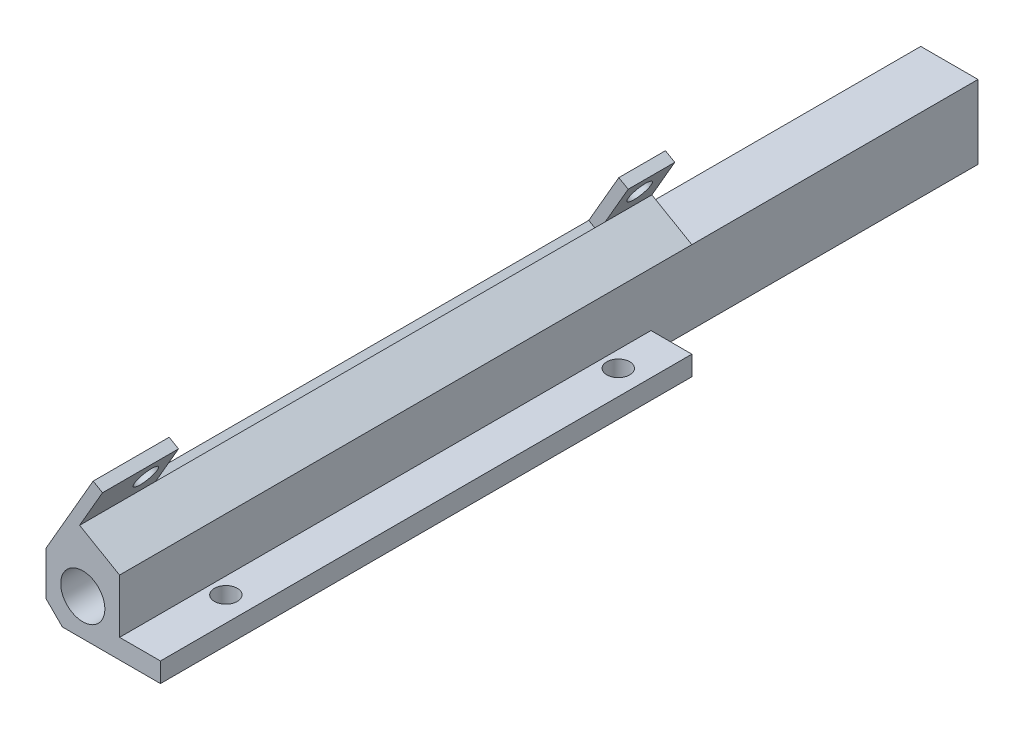
from build123d import *

# Parameters (mm, degrees)
SKETCH1_W           = 77.47
SKETCH1_H           = 133.35
BOSS_EXTRUDE1_DEPTH = 11.43
SKETCH2_R           = 3.429
CUT_EXTRUDE1_DEPTH  = 155.643035084
CUT_EXTRUDE2_DEPTH  = 155.643035084
SKETCH4_W           = 54.61
SKETCH4_H           = 6.35
CUT_EXTRUDE3_DEPTH  = 155.643035084
CHAMFER1_SIZE       = 2.54
CUT_EXTRUDE4_DEPTH  = 155.643035084
SKETCH6_W           = 53.34
SKETCH6_H           = 82.55
CUT_EXTRUDE5_DEPTH  = 155.643035084
SKETCH7_R           = 1.778
HOLE_CUTS_1_DEPTH   = 136.664298546
BOSS_EXTRUDE5_DEPTH = 88.9
SKETCH18_W          = 6.35
SKETCH18_H          = 5.08
CUT_EXTRUDE13_DEPTH = 76.2
HOLE_CUTS_2_REACH   = 139.395
SKETCH19_R          = 1.778
SKETCH20_W          = 88.9
SKETCH20_H          = 11.176
CUT_EXTRUDE16_DEPTH = 1.27
CUT_EXTRUDE22_DEPTH = 138.119873732
SKETCH22_W          = 6.35
SKETCH22_H          = 82.55
CUT_EXTRUDE18_DEPTH = 2.032
SKETCH23_W          = 1.676805636
SKETCH23_H          = 88.9
BOSS_EXTRUDE6_DEPTH = 1.27
CUT_EXTRUDE19_REACH = 139.539
SKETCH24_W          = 69.85
SKETCH24_H          = 9.3345
CUT_EXTRUDE20_REACH = 137.332
SKETCH25_W          = 1.27
SKETCH25_H          = 88.9
CUT_EXTRUDE21_REACH = 138.569
SKETCH26_W          = 6.35
SKETCH26_H          = 6.35


with BuildPart() as part:
    # Sketch1 → Boss-Extrude1 (new body)
    with BuildSketch(Plane(origin=(0, 0, 0), x_dir=(1, 0, 0), z_dir=(0, 1, 0))):
        with Locations((38.735, 66.675)):
            Rectangle(SKETCH1_W, SKETCH1_H)
    extrude(amount=BOSS_EXTRUDE1_DEPTH)

    # Sketch2 → Cut-Extrude1 (cut, through all)
    with BuildSketch(Plane.XY):
        with Locations((5.715, 5.715)):
            Circle(SKETCH2_R)
        with Locations((71.755, 5.715)):
            Circle(SKETCH2_R)
    extrude(amount=-CUT_EXTRUDE1_DEPTH, mode=Mode.SUBTRACT)

    # Sketch3 → Cut-Extrude2 (cut, through all)
    with BuildSketch(Plane(origin=(0, 11.43, 0), x_dir=(1, 0, 0), z_dir=(0, 1, 0))):
        with BuildLine():
            Line((11.43, 133.35), (11.43, 95.25))
            ThreePointArc((11.43, 95.25), (15.149743879, 86.269743879), (24.13, 82.55))
            Line((24.13, 82.55), (53.34, 82.55))
            ThreePointArc((53.34, 82.55), (62.320256121, 86.269743879), (66.04, 95.25))
            Line((66.04, 95.25), (66.04, 133.35))
            Line((66.04, 133.35), (11.43, 133.35))
        make_face()
    extrude(amount=-CUT_EXTRUDE2_DEPTH, mode=Mode.SUBTRACT)

    # Sketch4 → Cut-Extrude3 (cut, through all)
    with BuildSketch(Plane(origin=(0, 0, -133.35), x_dir=(-1, 0, 0), z_dir=(0, 0, -1))):
        with Locations((-38.735, 8.255)):
            Rectangle(SKETCH4_W, SKETCH4_H)
    extrude(amount=-CUT_EXTRUDE3_DEPTH, mode=Mode.SUBTRACT)

    # Chamfer1
    chamfer1_edges = [part.edges().sort_by_distance(p)[0] for p in [
        (0, 0, -66.675),
        (0, 11.43, -66.675),
        (77.47, 0, -66.675),
        (77.47, 11.43, -66.675),
    ]]
    chamfer(chamfer1_edges, length=CHAMFER1_SIZE)

    # Sketch5 → Cut-Extrude4 (cut, through all)
    with BuildSketch(Plane(origin=(0, 11.43, 0), x_dir=(1, 0, 0), z_dir=(0, 1, 0))):
        Polygon((11.43, 95.25), (11.43, 82.55), (77.47, 82.55), (77.47, 133.35), (11.43, 133.35), align=None)
    extrude(amount=-CUT_EXTRUDE4_DEPTH, mode=Mode.SUBTRACT)

    # Sketch6 → Cut-Extrude5 (cut, through all)
    with BuildSketch(Plane(origin=(0, 11.43, 0), x_dir=(1, 0, 0), z_dir=(0, 1, 0))):
        with Locations((50.8, 41.275)):
            Rectangle(SKETCH6_W, SKETCH6_H)
    extrude(amount=-CUT_EXTRUDE5_DEPTH, mode=Mode.SUBTRACT)

    # Sketch7 → Hole Cuts 1 (cut, through all)
    with BuildSketch(Plane(origin=(0, 5.08, 0), x_dir=(1, 0, 0), z_dir=(0, 1, 0))):
        with Locations((13.97, 74.93)):
            Circle(SKETCH7_R)
        with Locations((13.97, 13.97)):
            Circle(SKETCH7_R)
    extrude(amount=-HOLE_CUTS_1_DEPTH, mode=Mode.SUBTRACT)

    # Sketch17 → Boss-Extrude5 (add)
    with BuildSketch(Plane.XY):
        Polygon((0, 8.89), (0, 11.869940905), (5.588, 21.548640818), (8.851738686, 19.664320409), (5.930738686, 14.605), (11.43, 11.43), (2.54, 11.43), align=None)
    extrude(amount=-BOSS_EXTRUDE5_DEPTH)

    # Sketch18 → Cut-Extrude13 (cut)
    with BuildSketch(Plane.XY):
        with Locations((20.955, 2.54)):
            Rectangle(SKETCH18_W, SKETCH18_H)
    extrude(amount=-CUT_EXTRUDE13_DEPTH, mode=Mode.SUBTRACT)

    # Sketch19 → Hole Cuts 2 (cut, up to next)
    with BuildSketch(Plane(origin=(-1.876096497, 1.083164817, 0), x_dir=(0, 0, -1), z_dir=(0.8660254037844362, -0.5000000000000042, 0)), mode=Mode.PRIVATE) as hole_cuts_2_sk1:
        with Locations((8.382, 19.423670365)):
            Circle(SKETCH19_R)
    hole_cuts_2_tool1 = extrude(hole_cuts_2_sk1.sketch, amount=-HOLE_CUTS_2_REACH, mode=Mode.PRIVATE) & part.part
    # Sketch19 → Hole Cuts 2 (cut, up to next)
    with BuildSketch(Plane(origin=(-1.876096497, 1.083164817, 0), x_dir=(0, 0, -1), z_dir=(0.8660254037844362, -0.5000000000000042, 0)), mode=Mode.PRIVATE) as hole_cuts_2_sk2:
        with Locations((85.09, 19.423670365)):
            Circle(SKETCH19_R)
    hole_cuts_2_tool2 = extrude(hole_cuts_2_sk2.sketch, amount=-HOLE_CUTS_2_REACH, mode=Mode.PRIVATE) & part.part
    add(hole_cuts_2_tool1.solids().sort_by_distance((7.835739, 17.904557, -8.382))[0], mode=Mode.SUBTRACT)
    add(hole_cuts_2_tool2.solids().sort_by_distance((7.835739, 17.904557, -85.09))[0], mode=Mode.SUBTRACT)

    # Sketch20 → Cut-Extrude16 (cut)
    with BuildSketch(Plane(origin=(-5.139835183, 2.967485226, 0), x_dir=(0, 0, 1), z_dir=(-0.8660254037844362, 0.5000000000000042, 0))):
        with Locations((-44.45, 15.867670365)):
            Rectangle(SKETCH20_W, SKETCH20_H)
    extrude(amount=-CUT_EXTRUDE16_DEPTH, mode=Mode.SUBTRACT)

    # Sketch31 → Cut-Extrude22 (cut, through all)
    with BuildSketch(Plane.XY):
        Polygon((8.14000854, 20.075238), (12.539417591, 17.535238), (9.618417591, 12.475917591), (5.21900854, 15.015917591), align=None)
    extrude(amount=-CUT_EXTRUDE22_DEPTH, mode=Mode.SUBTRACT)

    # Sketch22 → Cut-Extrude18 (cut)
    with BuildSketch(Plane(origin=(0, 5.08, 0), x_dir=(1, 0, 0), z_dir=(0, 1, 0))):
        with Locations((14.605, 41.275)):
            Rectangle(SKETCH22_W, SKETCH22_H)
    extrude(amount=-CUT_EXTRUDE18_DEPTH, mode=Mode.SUBTRACT)

    # Sketch23 → Boss-Extrude6 (add)
    with BuildSketch(Plane(origin=(10.727835183, 18.581155592, 0), x_dir=(0.8660254037844366, -0.5000000000000037, 0), z_dir=(0.5000000000000036, 0.8660254037844365, 0))):
        with Locations((-3.826567635, 44.45)):
            Rectangle(SKETCH23_W, SKETCH23_H)
    extrude(amount=BOSS_EXTRUDE6_DEPTH)

    # Sketch24 → Cut-Extrude19 (cut, up to next)
    with BuildSketch(Plane(origin=(-2.587826643, 1.494082409, 0), x_dir=(0, 0, -1), z_dir=(0.86602540378444, -0.4999999999999977, 0)), mode=Mode.PRIVATE) as cut_extrude19_sk1:
        with Locations((46.736, 18.058420365)):
            Rectangle(SKETCH24_W, SKETCH24_H)
    cut_extrude19_tool1 = extrude(cut_extrude19_sk1.sketch, amount=-CUT_EXTRUDE19_REACH, mode=Mode.PRIVATE) & part.part
    add(cut_extrude19_tool1.solids().sort_by_distance((6.441384, 17.133133, -46.736))[0], mode=Mode.SUBTRACT)

    # Sketch25 → Cut-Extrude20 (cut, up to next)
    with BuildSketch(Plane(origin=(5.139835183, 8.902455679, 0), x_dir=(0.8660254037844362, -0.5000000000000046, 0), z_dir=(0.5000000000000044, 0.866025403784436, 0)), mode=Mode.PRIVATE) as cut_extrude20_sk1:
        with Locations((-5.299970453, 44.45)):
            Rectangle(SKETCH25_W, SKETCH25_H)
    cut_extrude20_tool1 = extrude(cut_extrude20_sk1.sketch, amount=-CUT_EXTRUDE20_REACH, mode=Mode.PRIVATE) & part.part
    add(cut_extrude20_tool1.solids().sort_by_distance((0.549926, 11.552441, -44.45))[0], mode=Mode.SUBTRACT)

    # Sketch26 → Cut-Extrude21 (cut, up to next)
    with BuildSketch(Plane(origin=(0, 5.08, 0), x_dir=(1, 0, 0), z_dir=(0, 1, 0)), mode=Mode.PRIVATE) as cut_extrude21_sk1:
        with Locations((20.955, 79.375)):
            Rectangle(SKETCH26_W, SKETCH26_H)
    cut_extrude21_tool1 = extrude(cut_extrude21_sk1.sketch, amount=-CUT_EXTRUDE21_REACH, mode=Mode.PRIVATE) & part.part
    add(cut_extrude21_tool1.solids().sort_by_distance((20.955, 5.08, -79.375))[0], mode=Mode.SUBTRACT)


solid = part.part
